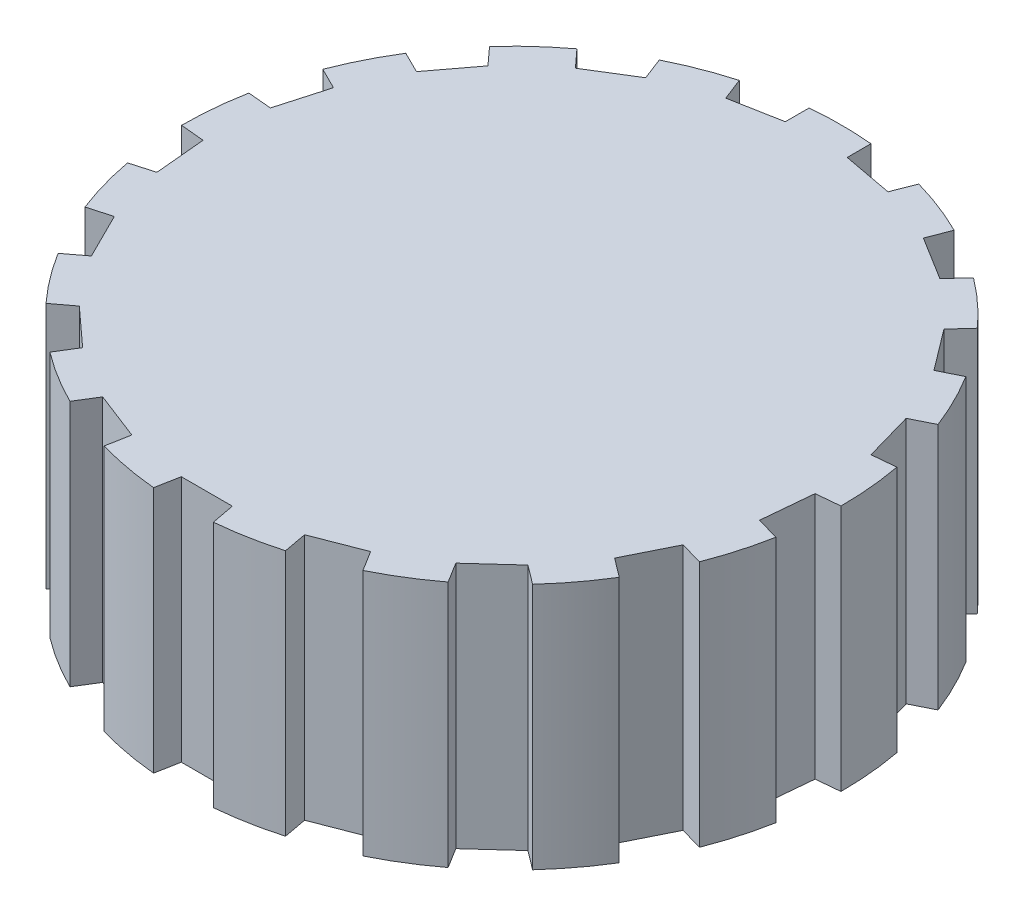
from build123d import *

# Parameters (mm, degrees)
SKETCH1_R           = 25.4
BOSS_EXTRUDE1_DEPTH = 19.05
CUT_EXTRUDE1_DEPTH  = 33
CIRPATTERN1_COUNT   = 17


with BuildPart() as part:
    # Sketch1 → Boss-Extrude1 (new body)
    with BuildSketch(Plane(origin=(0, 0, 0), x_dir=(1, 0, 0), z_dir=(0, 1, 0))):
        Circle(SKETCH1_R)
    extrude(amount=BOSS_EXTRUDE1_DEPTH)

    # Sketch2 → Cut-Extrude1 (cut)
    with BuildSketch(Plane.XZ):
        Polygon((0, 25.4), (2.3241, 25.4), (1.965720517, 23.495), (-1.965720517, 23.495), (-2.3241, 25.4), align=None)
    cut_extrude1 = extrude(amount=-CUT_EXTRUDE1_DEPTH, mode=Mode.SUBTRACT)

    # CirPattern1: Cut-Extrude1 ×17 about axis
    cirpattern1_axis = Axis((0, 0, 0), (0, 1, 0))
    for i in range(1, CIRPATTERN1_COUNT):
        add(cut_extrude1.rotate(cirpattern1_axis, i * 360 / CIRPATTERN1_COUNT), mode=Mode.SUBTRACT)


solid = part.part
